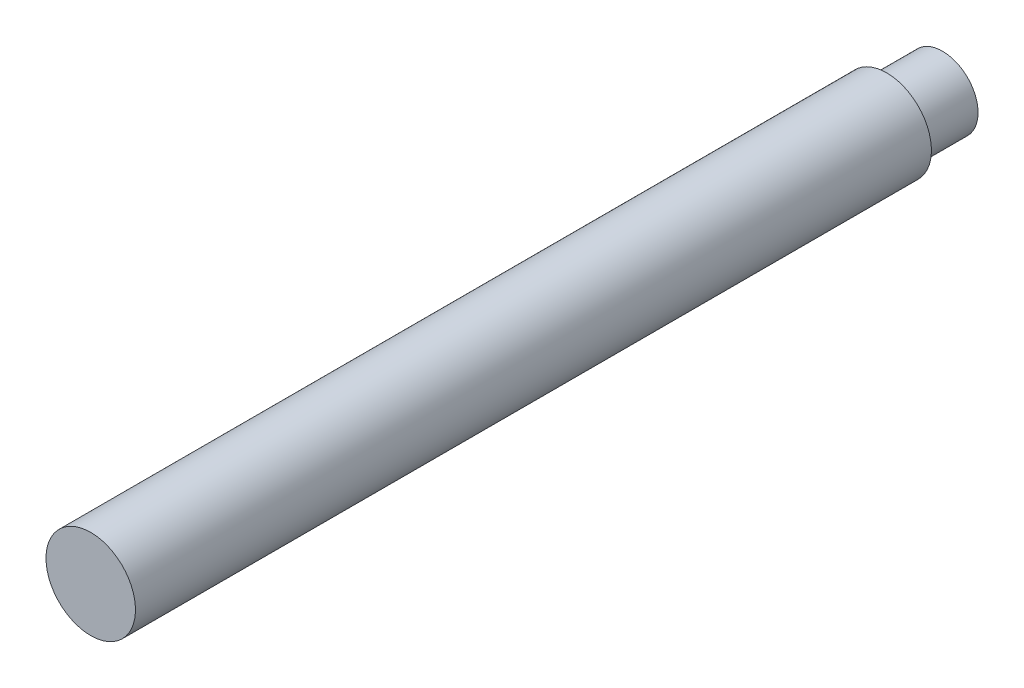
from build123d import *

# Parameters (mm, degrees)
SKETCH1_R           = 4.0005
BOSS_EXTRUDE1_DEPTH = 76.2
SKETCH2_R           = 6.466915926
SKETCH2_R_2         = 3.175
CUT_EXTRUDE1_DEPTH  = 5


with BuildPart() as part:
    # Sketch1 → Boss-Extrude1 (new body)
    with BuildSketch(Plane.XY):
        Circle(SKETCH1_R)
    extrude(amount=BOSS_EXTRUDE1_DEPTH)

    # Sketch2 → Cut-Extrude1 (cut)
    with BuildSketch(Plane(origin=(0, 0, 0), x_dir=(-1, 0, 0), z_dir=(0, 0, -1))):
        Circle(SKETCH2_R)
        Circle(SKETCH2_R_2, mode=Mode.SUBTRACT)
    extrude(amount=-CUT_EXTRUDE1_DEPTH, mode=Mode.SUBTRACT)


solid = part.part
